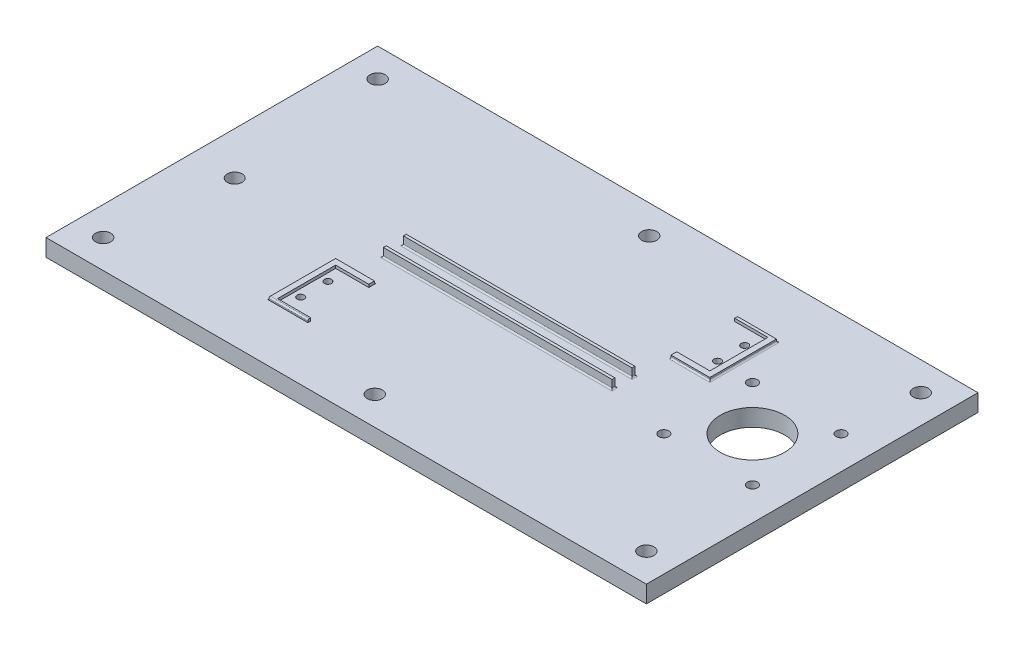
from build123d import *

# Parameters (mm, degrees)
SKETCH1_W           = 210
SKETCH1_H           = 116
SKETCH1_R           = 2.65
SKETCH1_R_2         = 11.25
SKETCH1_R_3         = 1.75
SKETCH1_R_4         = 2.6
BOSS_EXTRUDE1_DEPTH = 6
SKETCH4_R           = 1.25
CUT_EXTRUDE1_DEPTH  = 5.5
BOSS_EXTRUDE3_DEPTH = 1
BOSS_EXTRUDE4_DEPTH = 1
SKETCH4_5_R         = 1.25
CUT_EXTRUDE2_DEPTH  = 5.5
SKETCH6_W           = 80
SKETCH6_H           = 1
BOSS_EXTRUDE5_DEPTH = 3
FILLET1_R           = 0.5


with BuildPart() as part:
    # Sketch1 → Boss-Extrude1 (new body)
    with BuildSketch(Plane(origin=(0, 0, 0), x_dir=(1, 0, 0), z_dir=(0, 1, 0))):
        Rectangle(SKETCH1_W, SKETCH1_H)
        with Locations(Location((-95, 48, 0), (0, 0, 270))):
            Circle(SKETCH1_R, mode=Mode.SUBTRACT)
        with Locations(Location((95, 48, 0), (0, 0, 90))):
            Circle(SKETCH1_R, mode=Mode.SUBTRACT)
        with Locations(Location((95, -48, 0), (0, 0, 270))):
            Circle(SKETCH1_R, mode=Mode.SUBTRACT)
        with Locations(Location((-95, -48, 0), (0, 0, 90))):
            Circle(SKETCH1_R, mode=Mode.SUBTRACT)
        with Locations(Location((78, 6.11, 0), (0, 0, 270))):
            Circle(SKETCH1_R_2, mode=Mode.SUBTRACT)
        with Locations(Location((93.5, 21.61, 0), (0, 0, 270))):
            Circle(SKETCH1_R_3, mode=Mode.SUBTRACT)
        with Locations(Location((62.5, 21.61, 0), (0, 0, 270))):
            Circle(SKETCH1_R_3, mode=Mode.SUBTRACT)
        with Locations(Location((62.5, -9.39, 0), (0, 0, 270))):
            Circle(SKETCH1_R_3, mode=Mode.SUBTRACT)
        with Locations(Location((93.5, -9.39, 0), (0, 0, 270))):
            Circle(SKETCH1_R_3, mode=Mode.SUBTRACT)
        with Locations(Location((-90, -7, 0), (0, 0, 270))):
            Circle(SKETCH1_R_4, mode=Mode.SUBTRACT)
        with Locations(Location((0, 48, 0), (0, 0, 270))):
            Circle(SKETCH1_R, mode=Mode.SUBTRACT)
        with Locations(Location((0, -48, 0), (0, 0, 90))):
            Circle(SKETCH1_R, mode=Mode.SUBTRACT)
    extrude(amount=BOSS_EXTRUDE1_DEPTH)

    # Sketch4 → Cut-Extrude1 (cut)
    with BuildSketch(Plane(origin=(0, 6, 0), x_dir=(1, 0, 0), z_dir=(0, 1, 0))):
        with Locations(Location((49.9, 31.5, 0), (0, 0, 270))):
            Circle(SKETCH4_R)
        with Locations(Location((49.9, 22, 0), (0, 0, 270))):
            Circle(SKETCH4_R)
    extrude(amount=-CUT_EXTRUDE1_DEPTH, mode=Mode.SUBTRACT)

    # Sketch4<3> → Boss-Extrude3 (add)
    with BuildSketch(Plane(origin=(0, 6, 0), x_dir=(1, 0, 0), z_dir=(0, 1, 0))):
        Polygon((40.9, 37), (52.5, 37), (52.5, 16.7), (40.9, 16.7), (40.9, 14.7), (54.5, 14.7), (54.5, 38), (40.9, 38), align=None)
    extrude(amount=BOSS_EXTRUDE3_DEPTH)

    # Sketch4<4> → Boss-Extrude4 (add)
    with BuildSketch(Plane(origin=(0, 6, 0), x_dir=(1, 0, 0), z_dir=(0, 1, 0))):
        Polygon((-45, -16.7), (-33.4, -16.7), (-33.4, -14.7), (-47, -14.7), (-47, -38), (-33.4, -38), (-33.4, -37), (-45, -37), align=None)
    extrude(amount=BOSS_EXTRUDE4_DEPTH)

    # Sketch4<5> → Cut-Extrude2 (cut)
    with BuildSketch(Plane(origin=(0, 6, 0), x_dir=(1, 0, 0), z_dir=(0, 1, 0))):
        with Locations(Location((-42.4, -22, 0), (0, 0, 270))):
            Circle(SKETCH4_5_R)
        with Locations(Location((-42.4, -31.5, 0), (0, 0, 270))):
            Circle(SKETCH4_5_R)
    extrude(amount=-CUT_EXTRUDE2_DEPTH, mode=Mode.SUBTRACT)

    # Sketch6 → Boss-Extrude5 (add)
    with BuildSketch(Plane(origin=(0, 6, 0), x_dir=(1, 0, 0), z_dir=(0, 1, 0))):
        with Locations((0, 2.5)):
            Rectangle(SKETCH6_W, SKETCH6_H)
        with Locations((0, -4.5)):
            Rectangle(SKETCH6_W, SKETCH6_H)
    extrude(amount=BOSS_EXTRUDE5_DEPTH)

    # Fillet1
    fillet1_edges = [part.edges().sort_by_distance(p)[0] for p in [
        (54.5, 6, -26.35),
        (40, 6, -2.5),
        (40, 6, 4.5),
        (0, 6, -2),
        (0, 6, -3),
        (-40, 6, -2.5),
        (0, 6, 4),
        (-40, 6, 4.5),
        (0, 6, 5),
        (-47, 6, 26.35),
        (47.7, 6, -38),
        (47.7, 6, -14.7),
        (-40.2, 6, 14.7),
        (-40.2, 7, 38),
    ]]
    fillet(fillet1_edges, radius=FILLET1_R - 0.0001)  # a hair under: the kernel refuses the full size


solid = part.part
